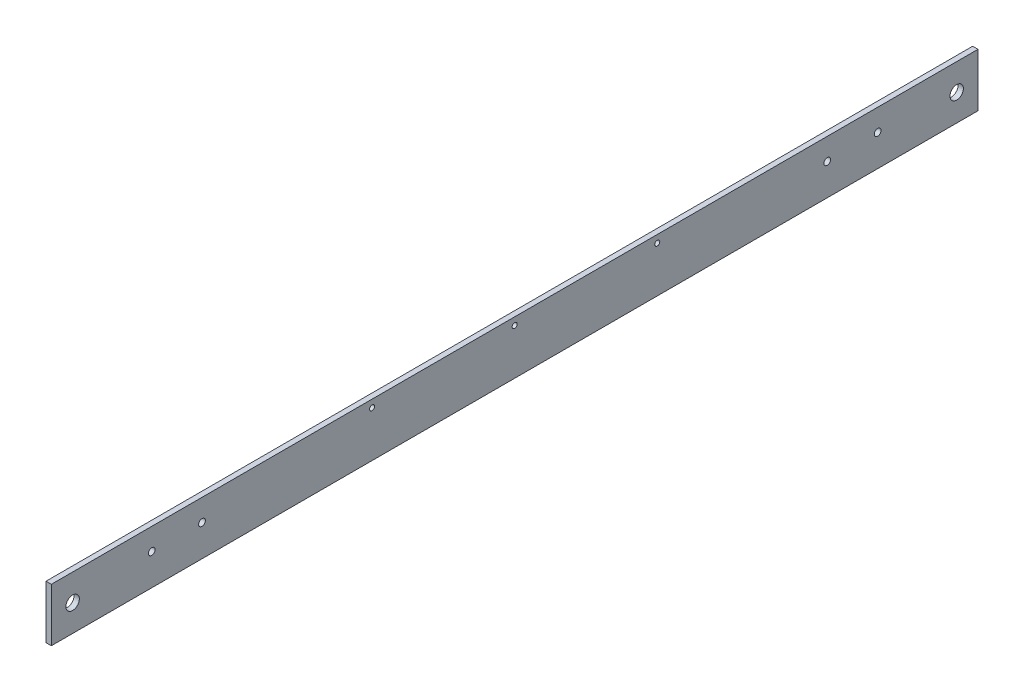
from build123d import *

# Parameters (mm, degrees)
SKETCH1_W                              = 552.45
SKETCH1_H                              = 31.75
SKETCH1_R                              = 4
SKETCH1_R_2                            = 2
BOSS_EXTRUDE2_DEPTH                    = 3.175
SKETCH2_R                              = 1.5
LIGHTGUIDEMOUNTHOLESCUT_EXTRUDE1_DEPTH = 554.370712656


with BuildPart() as part:
    # Sketch1 → Boss-Extrude2 (new body)
    with BuildSketch(Plane(origin=(0, 0, 0), x_dir=(0, 0, -1), z_dir=(1, 0, 0))):
        with Locations((276.225, 15.875)):
            Rectangle(SKETCH1_W, SKETCH1_H)
        with Locations((12.7, 15.875)):
            Circle(SKETCH1_R, mode=Mode.SUBTRACT)
        with Locations((539.75, 15.875)):
            Circle(SKETCH1_R, mode=Mode.SUBTRACT)
        with Locations((462.625, 18.75)):
            Circle(SKETCH1_R_2, mode=Mode.SUBTRACT)
        with Locations((492.625, 18.75)):
            Circle(SKETCH1_R_2, mode=Mode.SUBTRACT)
        with Locations((59.825, 18.75)):
            Circle(SKETCH1_R_2, mode=Mode.SUBTRACT)
        with Locations((89.825, 18.75)):
            Circle(SKETCH1_R_2, mode=Mode.SUBTRACT)
    extrude(amount=BOSS_EXTRUDE2_DEPTH)

    # Sketch2 → LightGuideMountHolesCut-Extrude1 (cut, through all)
    with BuildSketch(Plane(origin=(3.175, 0, 0), x_dir=(0, 0, -1), z_dir=(1, 0, 0))):
        with Locations((191.225, 27.25)):
            Circle(SKETCH2_R)
        with Locations((276.225, 27.25)):
            Circle(SKETCH2_R)
        with Locations((361.225, 27.25)):
            Circle(SKETCH2_R)
    extrude(amount=-LIGHTGUIDEMOUNTHOLESCUT_EXTRUDE1_DEPTH, mode=Mode.SUBTRACT)


solid = part.part
